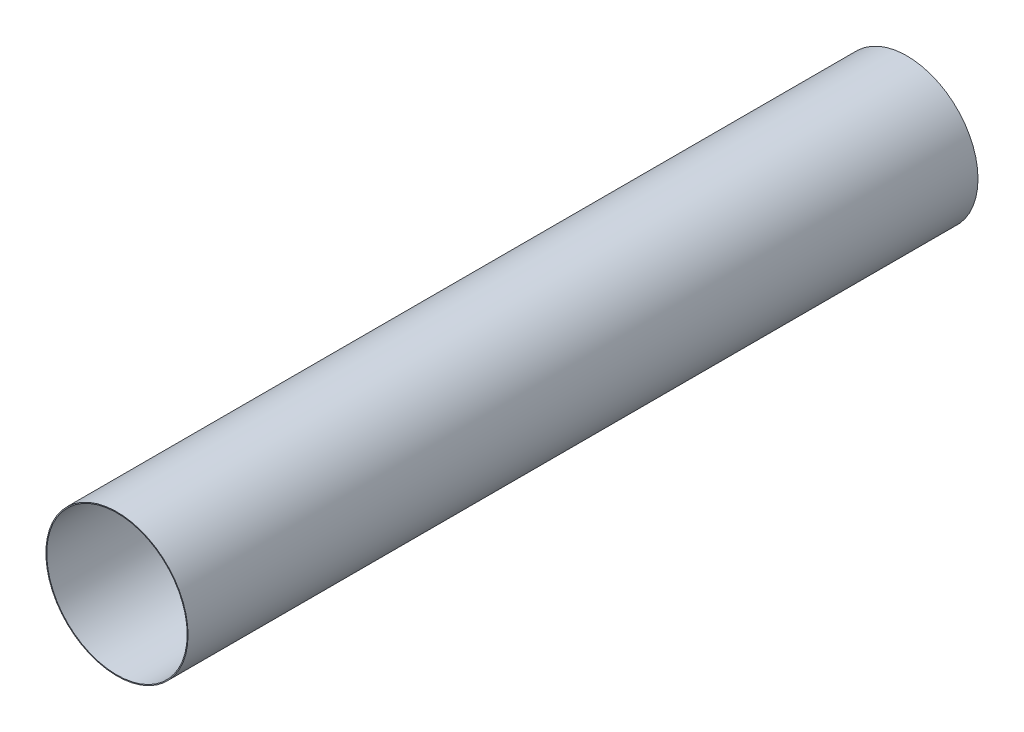
from build123d import *

# Parameters (mm, degrees)
SKETCH1_R           = 81
SKETCH1_R_2         = 80
BOSS_EXTRUDE1_DEPTH = 450


with BuildPart() as part:
    # Sketch1 → Boss-Extrude1 (new, symmetric)
    with BuildSketch(Plane.XY):
        Circle(SKETCH1_R)
        Circle(SKETCH1_R_2, mode=Mode.SUBTRACT)
    extrude(amount=BOSS_EXTRUDE1_DEPTH, both=True)


solid = part.part
